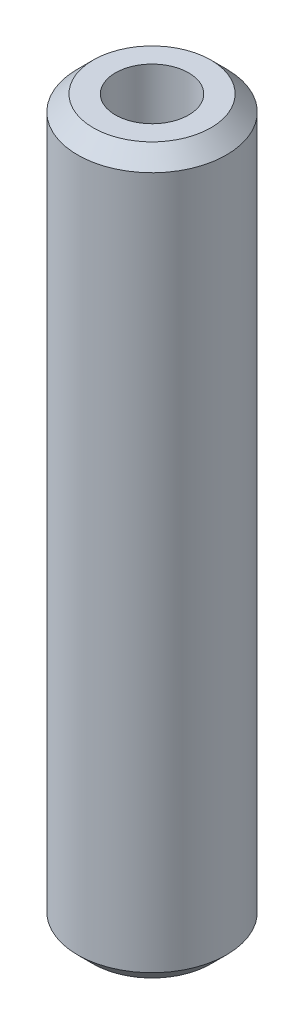
from build123d import *

# Parameters (mm, degrees)
SKETCH1_R           = 25
BOSS_EXTRUDE1_DEPTH = 243.162077868
SKETCH2_R           = 12.287884458
CUT_EXTRUDE1_DEPTH  = 246.718937229
CHAMFER1_SIZE       = 5.260166704


with BuildPart() as part:
    # Sketch1 → Boss-Extrude1 (new body)
    with BuildSketch(Plane(origin=(0, 0, 0), x_dir=(1, 0, 0), z_dir=(0, 1, 0))):
        Circle(SKETCH1_R)
    extrude(amount=BOSS_EXTRUDE1_DEPTH)

    # Sketch2 → Cut-Extrude1 (cut, through all)
    with BuildSketch(Plane(origin=(0, 0, 0), x_dir=(1, 0, 0), z_dir=(0, 1, 0))):
        Circle(SKETCH2_R)
    extrude(amount=CUT_EXTRUDE1_DEPTH, mode=Mode.SUBTRACT)

    # Chamfer1
    chamfer1_edges = [part.edges().sort_by_distance(p)[0] for p in [
        (-25, 243.162077868, 0),
        (-25, 0, 0),
    ]]
    chamfer(chamfer1_edges, length=CHAMFER1_SIZE)


solid = part.part
